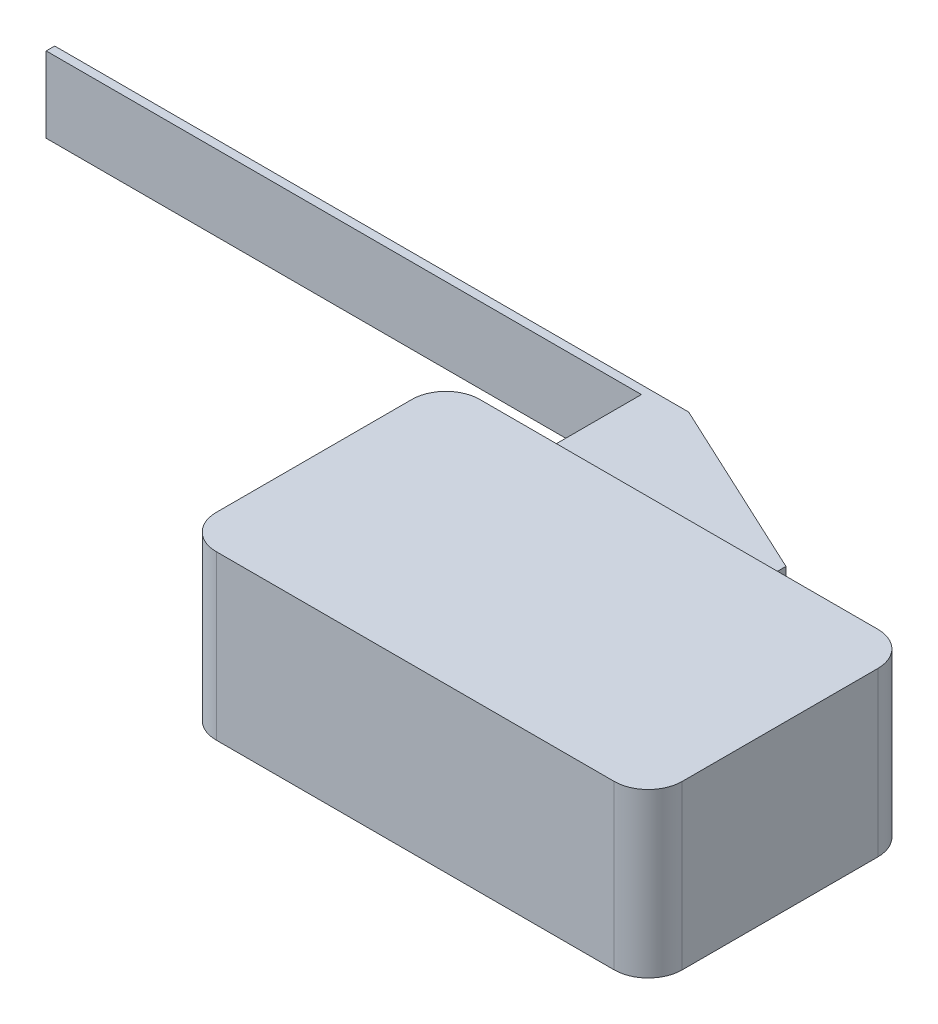
from build123d import *

# Parameters (mm, degrees)
SKETCH1_W           = 27.4
SKETCH1_H           = 15.5
BOSS_EXTRUDE1_DEPTH = 9.6
FILLET1_R           = 2
SKETCH2_W           = 13
SKETCH2_H           = 4.45
BOSS_EXTRUDE2_DEPTH = 8
SKETCH3_W           = 0.5
SKETCH3_H           = 4.45
BOSS_EXTRUDE3_DEPTH = 35
CHAMFER1_SIZE       = 5
CHAMFER1_SIZE2      = 10.722534603


with BuildPart() as part:
    # Sketch1 → Boss-Extrude1 (new body)
    with BuildSketch(Plane(origin=(0, 0, 0), x_dir=(1, 0, 0), z_dir=(0, 1, 0))):
        with Locations((13.7, 7.75)):
            Rectangle(SKETCH1_W, SKETCH1_H)
    extrude(amount=BOSS_EXTRUDE1_DEPTH)

    # Fillet1
    fillet1_edges = [part.edges().sort_by_distance(p)[0] for p in [
        (0, 4.8, -15.5),
        (27.4, 4.8, -15.5),
        (0, 4.8, 0),
        (27.4, 4.8, 0),
    ]]
    fillet(fillet1_edges, radius=FILLET1_R)

    # Sketch2 → Boss-Extrude2 (add)
    with BuildSketch(Plane(origin=(0, 0, -15.5), x_dir=(-1, 0, 0), z_dir=(0, 0, -1))):
        with Locations((-10.5, 4.875)):
            Rectangle(SKETCH2_W, SKETCH2_H)
    extrude(amount=BOSS_EXTRUDE2_DEPTH)

    # Sketch3 → Boss-Extrude3 (add)
    with BuildSketch(Plane.ZY.offset(-4)):
        with Locations((-23.25, 4.875)):
            Rectangle(SKETCH3_W, SKETCH3_H)
    extrude(amount=BOSS_EXTRUDE3_DEPTH)

    # Chamfer1
    chamfer1_edges = [part.edges().sort_by_distance(p)[0] for p in [
        (17, 4.875, -23.5),
    ]]
    chamfer1_side = [part.faces().sort_by_distance(p)[0] for p in [
        (17, 4.875, -19.5),
    ]]
    chamfer(chamfer1_edges, length=CHAMFER1_SIZE, length2=CHAMFER1_SIZE2, reference=chamfer1_side[0])


solid = part.part
